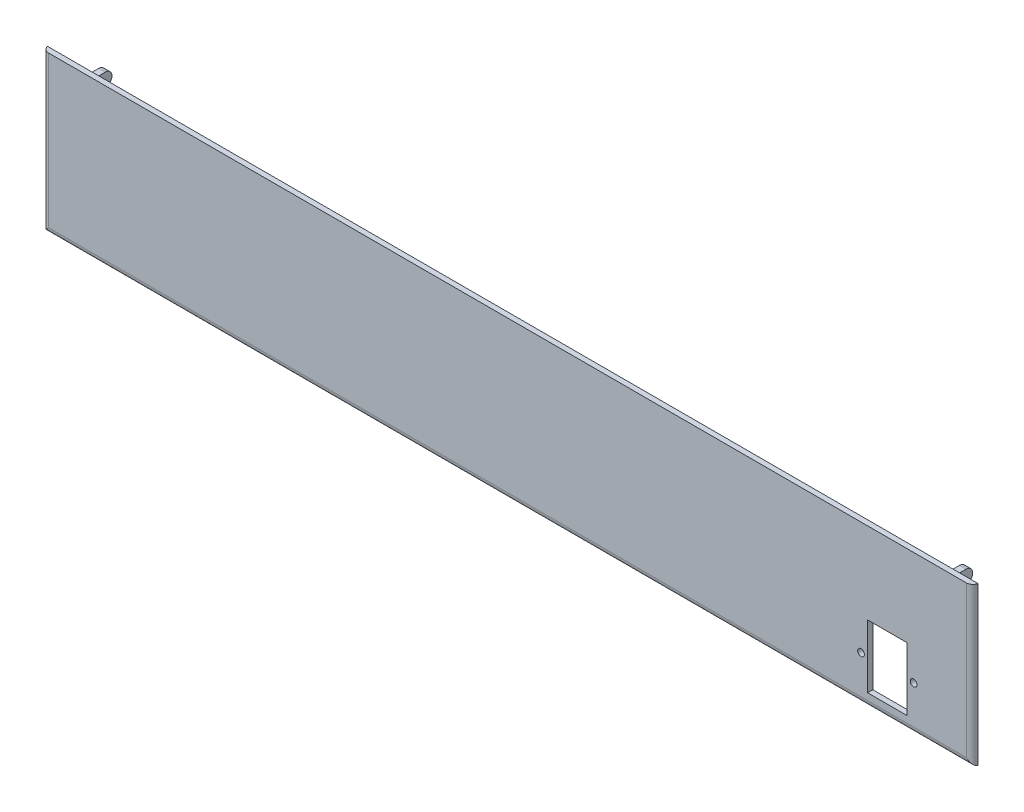
from build123d import *

# Parameters (mm, degrees)
SKETCH1_W              = 708
SKETCH1_H              = 120
BOSS_EXTRUDE1_DEPTH    = 4
CUT_EXTRUDE1_REACH     = 720.109
SKETCH2_R              = 2.55
SKETCH2_W              = 30
SKETCH2_H              = 48
SKETCH3_W              = 5
SKETCH3_H              = 10
BOSS_EXTRUDE2_DEPTH    = 20
SKETCH4_R              = 2.6
CUT_EXTRUDE2_DEPTH     = 20
FILLET1_R              = 5
LPATTERN1_COUNT        = 2
LPATTERN1_PITCH        = 85
FILLET1_OF_LPATTERN1_R = 5
MIRROR5_START          = 24
MIRROR5_OUTLINE_R      = 2.6
MIRROR5_DEPTH          = 5
FILLET2_R              = 5


# Read off the part's stored shape, not the designer's step: Mirror5
# Some blends are built 0.0001 mm under size
with BuildPart() as part:
    # Sketch1 → Boss-Extrude1 (new body)
    with BuildSketch(Plane.XY):
        with Locations((354, 60)):
            Rectangle(SKETCH1_W, SKETCH1_H)
    extrude(amount=BOSS_EXTRUDE1_DEPTH)

    # Sketch2 → Cut-Extrude1 (cut, up to next)
    with BuildSketch(Plane.XY.offset(4), mode=Mode.PRIVATE) as cut_extrude1_sk1:
        with Locations((623, 34)):
            Circle(SKETCH2_R)
    cut_extrude1_tool1 = extrude(cut_extrude1_sk1.sketch, amount=-CUT_EXTRUDE1_REACH, mode=Mode.PRIVATE) & part.part
    # Sketch2 → Cut-Extrude1 (cut, up to next)
    with BuildSketch(Plane.XY.offset(4), mode=Mode.PRIVATE) as cut_extrude1_sk2:
        with Locations((663, 34)):
            Circle(SKETCH2_R)
    cut_extrude1_tool2 = extrude(cut_extrude1_sk2.sketch, amount=-CUT_EXTRUDE1_REACH, mode=Mode.PRIVATE) & part.part
    # Sketch2 → Cut-Extrude1 (cut, up to next)
    with BuildSketch(Plane.XY.offset(4), mode=Mode.PRIVATE) as cut_extrude1_sk3:
        with Locations((643, 34)):
            Rectangle(SKETCH2_W, SKETCH2_H)
    cut_extrude1_tool3 = extrude(cut_extrude1_sk3.sketch, amount=-CUT_EXTRUDE1_REACH, mode=Mode.PRIVATE) & part.part
    add(cut_extrude1_tool1.solids().sort_by_distance((623, 34, 4))[0], mode=Mode.SUBTRACT)
    add(cut_extrude1_tool2.solids().sort_by_distance((663, 34, 4))[0], mode=Mode.SUBTRACT)
    add(cut_extrude1_tool3.solids().sort_by_distance((643, 34, 4))[0], mode=Mode.SUBTRACT)

    # Sketch3 → Boss-Extrude2 (add)
    with BuildSketch(Plane(origin=(0, 0, 0), x_dir=(-1, 0, 0), z_dir=(0, 0, -1))):
        with Locations((-681.5, 20)):
            Rectangle(SKETCH3_W, SKETCH3_H)
    boss_extrude2 = extrude(amount=BOSS_EXTRUDE2_DEPTH)

    # Sketch4 → Cut-Extrude2 (cut)
    with BuildSketch(Plane(origin=(684, 0, 0), x_dir=(0, 0, -1), z_dir=(1, 0, 0))):
        with Locations((10, 20)):
            Circle(SKETCH4_R)
    cut_extrude2 = extrude(amount=-CUT_EXTRUDE2_DEPTH, mode=Mode.SUBTRACT)

    # Fillet1
    fillet1_edges = [part.edges().sort_by_distance(p)[0] for p in [
        (681.5, 15, -20),
        (681.5, 25, -20),
    ]]
    fillet(fillet1_edges, radius=FILLET1_R - 0.0001)  # a hair under: the kernel refuses the full size

    # LPattern1: Boss-Extrude2, Cut-Extrude2 ×2
    with Locations(*[(0, i * LPATTERN1_PITCH, 0) for i in range(1, LPATTERN1_COUNT)]):
        add(boss_extrude2)
        add(cut_extrude2, mode=Mode.SUBTRACT)

    # Fillet1 of LPattern1
    fillet1_of_lpattern1_edges = [part.edges().sort_by_distance(p)[0] for p in [
        (681.5, 100, -20),
        (681.5, 110, -20),
    ]]
    fillet(fillet1_of_lpattern1_edges, radius=FILLET1_OF_LPATTERN1_R - 0.0001)  # a hair under: the kernel refuses the full size

    # Mirror5 outline → Mirror5 (add)
    # profile 1 of 2: a face of its own
    with BuildSketch(Plane.YZ.offset(MIRROR5_START)):
        with BuildLine():
            Line((25, 0), (15, 0))
            Line((15, 0), (15, -15))
            ThreePointArc((15, -15), (16.464466094, -18.535533906), (20, -20))
            ThreePointArc((20, -20), (23.535533906, -18.535533906), (25, -15))
            Line((25, -15), (25, 0))
        make_face()
        with Locations((20, -10)):
            Circle(MIRROR5_OUTLINE_R, mode=Mode.SUBTRACT)
    # profile 2 of 2: a face of its own
    with BuildSketch(Plane.YZ.offset(MIRROR5_START)):
        with BuildLine():
            Line((110, 0), (100, 0))
            Line((100, 0), (100, -15))
            ThreePointArc((100, -15), (101.464466094, -18.535533906), (105, -20))
            ThreePointArc((105, -20), (108.535533906, -18.535533906), (110, -15))
            Line((110, -15), (110, 0))
        make_face()
        with Locations((105, -10)):
            Circle(MIRROR5_OUTLINE_R, mode=Mode.SUBTRACT)
    extrude(amount=MIRROR5_DEPTH)

    # Fillet2
    # the kernel refuses this fillet: 5 mm, written as the material it takes off along each edge
    with BuildSketch(Plane(origin=(0, 132.247448714, 4), x_dir=(1.5589751711781488e-12, 0, -1.0), z_dir=(0, -1, 0)), Plane(origin=(708, -12.247448714, 4), x_dir=(-1.5631940186717186e-12, 0, -1.0), z_dir=(0, 1, 0))) as fillet2_piece_1:
        with BuildLine():
            CenterArc((5, 4.898979486), FILLET2_R, 180, 78.463040967)
            Line((0, 4.898979486), (-0.1, 4.898979486))
            Line((-0.1, 4.898979486), (-0.1, 0))
            Line((-0.1, 0), (0, -0.1))
            ThreePointArc((0, -0.1), (2, -0.1), (3.98, -0.09797959))
            Line((3.98, -0.09797959), (4, 0))
        make_face()
    extrude(amount=144.494897428, mode=Mode.SUBTRACT)
    with BuildSketch(Plane(origin=(-12.247448714, 0, 4), x_dir=(0, 1.5725198920785669e-12, -1.0), z_dir=(1, 0, 0))) as fillet2_piece_2:
        with BuildLine():
            CenterArc((5, 4.898979486), FILLET2_R, 180, 78.463040967)
            Line((0, 4.898979486), (-0.1, 4.898979486))
            Line((-0.1, 4.898979486), (-0.1, 0))
            Line((-0.1, 0), (0, -0.1))
            ThreePointArc((0, -0.1), (2, -0.1), (3.98, -0.09797959))
            Line((3.98, -0.09797959), (4, 0))
        make_face()
    extrude(amount=732.494897428, mode=Mode.SUBTRACT)


solid = part.part
